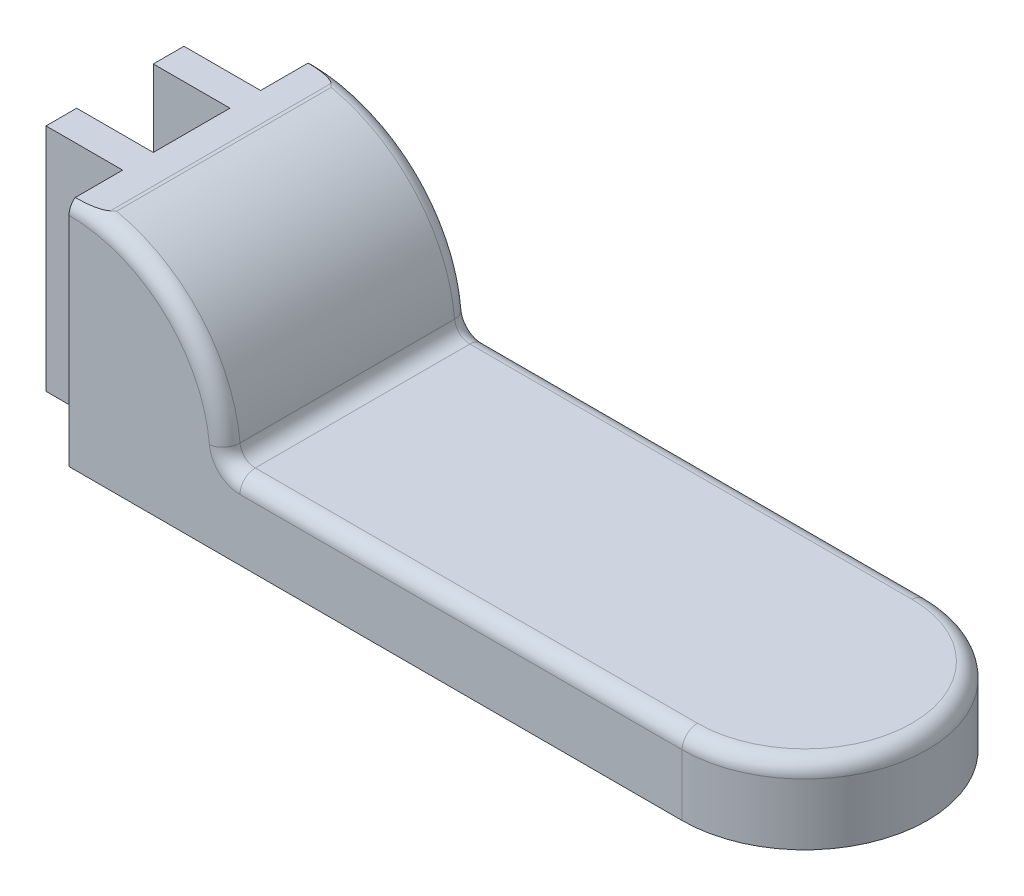
from build123d import *

# Parameters (mm, degrees)
CROQUIS1_R              = 80
SALIENTE_EXTRUIR1_DEPTH = 50
SALIENTE_EXTRUIR2_DEPTH = 160
REDONDEO1_R             = 10
SALIENTE_EXTRUIR3_DEPTH = 50
CROQUIS4_R              = 60
CORTAR_EXTRUIR1_DEPTH   = 30
REDONDEO2_R             = 3


with BuildPart() as part:
    # Croquis1 → Saliente-Extruir1 (new body)
    with BuildSketch(Plane(origin=(0, 0, 0), x_dir=(1, 0, 0), z_dir=(0, 1, 0))):
        Circle(CROQUIS1_R)
        with BuildLine():
            Line((-400, -80), (0, -80))
            ThreePointArc((-1.47e-14, -80), (-80, 9.8e-15), (4.9e-15, 80))
            Line((0, 80), (-400, 80))
            Line((-400, 80), (-400, -80))
        make_face()
    extrude(amount=-SALIENTE_EXTRUIR1_DEPTH)

    # Croquis2 → Saliente-Extruir2 (add)
    with BuildSketch(Plane.XY.offset(80)):
        with BuildLine():
            Line((-400, 0), (-400, 100))
            Line((-400, 100), (-380, 100))
            ThreePointArc((-380, 100), (-321.1342666126881, 64.65443602167947), (-298.01960972814436, 0))
            Line((-298.01960972814436, 0), (-400, 0))
        make_face()
    extrude(amount=-SALIENTE_EXTRUIR2_DEPTH)

    # Redondeo1
    # the kernel refuses this fillet: 10 mm, written as the material it adds along each edge
    with BuildSketch(Plane(origin=(-298.01960972814436, -1.78e-15, 80), x_dir=(-0.04469534055522645, 0.9990006639300358, 0), z_dir=(0, 0, -1))) as redondeo1_piece_1:
        with BuildLine():
            CenterArc((9.563049951863276, 9.990006639300384), REDONDEO1_R, 182.561707770238, 84.87658445952434)
            Line((-0.4269566874370806, 9.543053233748063), (0, 0))
            ThreePointArc((0, 0), (4.5580482731555065, 0.10191268242766027), (9.11609654631102, -3e-17))
        make_face()
    extrude(amount=160)
    # the kernel refuses this fillet: 10 mm, written as the material it takes off along each edge
    with BuildSketch(Plane(origin=(0, 0, 0), x_dir=(8e-17, 0, -1), z_dir=(-1, 0, -8e-17))) as redondeo1_2_piece_1:
        with BuildLine():
            CenterArc((80 - REDONDEO1_R, REDONDEO1_R), REDONDEO1_R, 270, 90)
            Line((80 - REDONDEO1_R, -1.78e-15), (80, 0))
            Line((80, 0), (80, REDONDEO1_R))
        make_face()
    revolve(axis=Axis((0, 0, 0), (0, -1, 0)), revolution_arc=180, mode=Mode.SUBTRACT)
    with BuildSketch(Plane(origin=(-288.467010237163, 0, 80), x_dir=(0, 0, -1), z_dir=(1, 0, 0)), Plane(origin=(0, 0, -80), x_dir=(0, 0, 1), z_dir=(-1, 0, 0))) as redondeo1_2_piece_2:
        with BuildLine():
            CenterArc((REDONDEO1_R, -REDONDEO1_R), REDONDEO1_R, 90, 90)
            Line((0, -REDONDEO1_R), (0, 0))
            Line((0, 0), (REDONDEO1_R, 0))
        make_face()
    extrude(amount=288.467010237163, mode=Mode.SUBTRACT)
    with BuildSketch(Plane(origin=(-379.9999999999998, 100, 82.6745154998789), x_dir=(0.9795385270864807, -0.20125673641706543, 0), z_dir=(0, 0, -1))) as redondeo1_2_piece_3:
        with BuildLine():
            CenterArc((1.0173546356310936, 9.999862440723893), REDONDEO1_R, 258.3895408215282, 11.91098588292175)
            Line((-0.9952127285396165, 0.20447716985909684), (0, 0))
            ThreePointArc((0, 0), (0.5349030999756575, -0.00140283486632694), (1.0698061999513302, -1e-17))
        make_face()
    extrude(amount=165.34903099975782, mode=Mode.SUBTRACT)
    with BuildSketch(Plane(origin=(-400, 1.1013e-13, -80), x_dir=(-0.04779718259448206, 0.9988570615138231, 0), z_dir=(-0.9988570615138231, -0.04779718259448206, 0))) as redondeo1_2_piece_4:
        with BuildLine():
            CenterArc((101.98039027185561 - REDONDEO1_R, -REDONDEO1_R), REDONDEO1_R, 0, 90)
            Line((101.98039027185561, -REDONDEO1_R), (101.98039027185561, 0))
            Line((101.98039027185561, 0), (101.98039027185561 - REDONDEO1_R, 0))
        make_face()
    revolve(axis=Axis((-400, 1.1013e-13, -80), (0, 0, -1)), revolution_arc=87.61620511364934, mode=Mode.SUBTRACT)
    with BuildSketch(Plane(origin=(-400, 1.1013e-13, 80), x_dir=(-0.04779718259448206, 0.9988570615138231, 0), z_dir=(-0.9988570615138231, -0.04779718259448206, 0))) as redondeo1_2_piece_5:
        with BuildLine():
            CenterArc((101.98039027185561 - REDONDEO1_R, REDONDEO1_R), REDONDEO1_R, 270, 90)
            Line((101.98039027185561, REDONDEO1_R), (101.98039027185561, 0))
            Line((101.98039027185561, 0), (101.98039027185561 - REDONDEO1_R, 0))
        make_face()
    revolve(axis=Axis((-400, 1.1013e-13, 80), (0, 0, -1)), revolution_arc=87.61620511364934, mode=Mode.SUBTRACT)
    with BuildSketch(Plane(origin=(-288.467010237163, 10.000000000000012, 80), x_dir=(-0.9960046530653047, -0.0893013497784993, 0), z_dir=(-0.0893013497784993, 0.9960046530653047, 0))) as redondeo1_2_piece_6:
        with BuildLine():
            CenterArc((10.000000000000025 + REDONDEO1_R, -REDONDEO1_R), REDONDEO1_R, 90, 90)
            Line((10.000000000000025, -REDONDEO1_R), (10.000000000000025, 0))
            Line((10.000000000000025, 0), (10.000000000000025 + REDONDEO1_R, 0))
        make_face()
    revolve(axis=Axis((-288.467010237163, 10.000000000000012, 80), (0, 0, 1)), revolution_arc=84.87658445952435, mode=Mode.SUBTRACT)
    with BuildSketch(Plane(origin=(-288.467010237163, 10.000000000000012, -80), x_dir=(-0.9960046530653047, -0.0893013497784993, 0), z_dir=(-0.0893013497784993, 0.9960046530653047, 0))) as redondeo1_2_piece_7:
        with BuildLine():
            CenterArc((10.000000000000025 + REDONDEO1_R, REDONDEO1_R), REDONDEO1_R, 180, 90)
            Line((10.000000000000025, REDONDEO1_R), (10.000000000000025, 0))
            Line((10.000000000000025, 0), (10.000000000000025 + REDONDEO1_R, 0))
        make_face()
    revolve(axis=Axis((-288.467010237163, 10.000000000000012, -80), (0, 0, 1)), revolution_arc=84.87658445952435, mode=Mode.SUBTRACT)

    # Croquis3 → Saliente-Extruir3 (add)
    with BuildSketch(Plane.ZY.offset(400)):
        Polygon((44.99999999999997, -50), (24.999999999999982, -50), (25, 100), (45, 100), align=None)
        Polygon((-45, 100), (-25, 100), (-24.999999999999982, -50), (-44.99999999999997, -50), align=None)
    extrude(amount=SALIENTE_EXTRUIR3_DEPTH)

    # Croquis4 → Cortar-Extruir1 (cut)
    with BuildSketch(Plane.XZ.offset(50)):
        with Locations(Location((0, 0, 0), (0, 0, 270))):
            Circle(CROQUIS4_R)
    extrude(amount=-CORTAR_EXTRUIR1_DEPTH, mode=Mode.SUBTRACT)

    # Redondeo2
    redondeo2_edges = [part.edges().sort_by_distance(p)[0] for p in [
        (4.502e-14, -50, 60),
    ]]
    fillet(redondeo2_edges, radius=REDONDEO2_R)


solid = part.part
